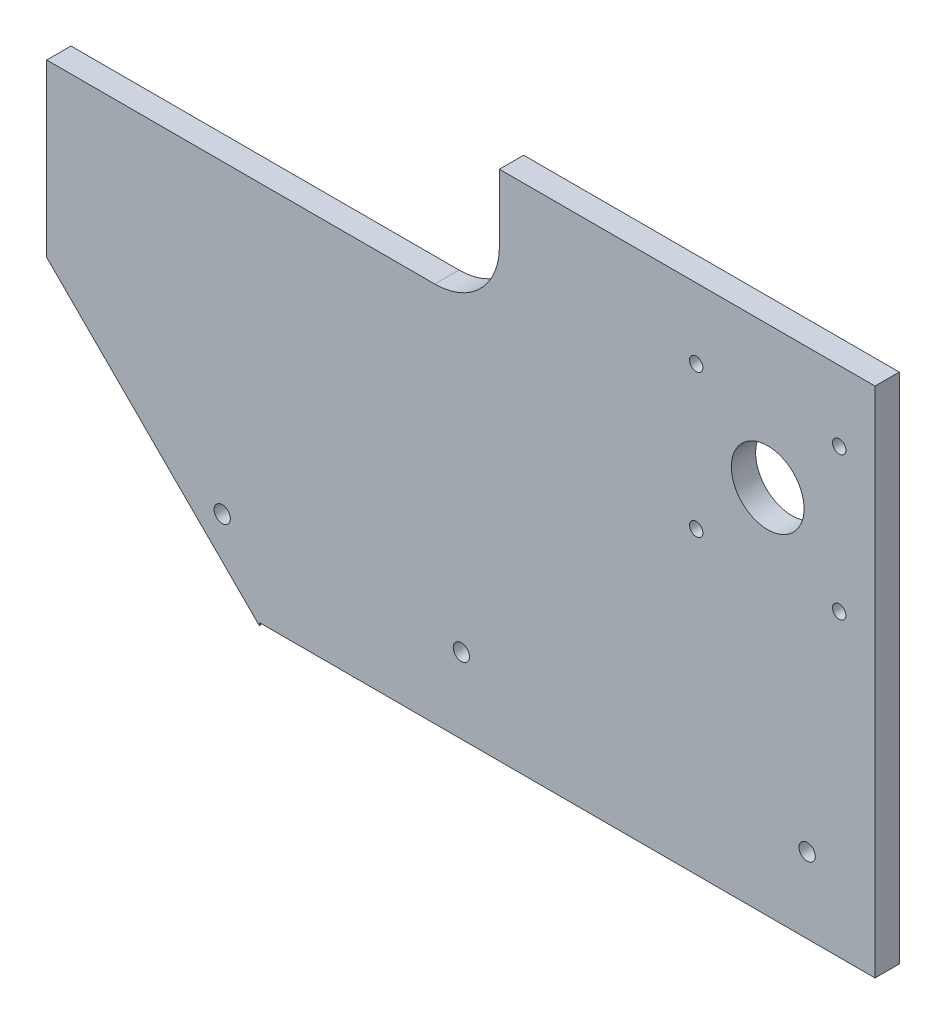
from build123d import *

# Parameters (mm, degrees)
SKETCH1_R                    = 14.2875
BOSS_EXTRUDE1_DEPTH          = 9.525
SKETCH2_W                    = 261.030867205
SKETCH2_H                    = 52.546989145
CUT_EXTRUDE1_DEPTH           = 269.40946762
SKETCH4_W                    = 213.36
SKETCH4_H                    = 68.767352002
CUT_EXTRUDE2_DEPTH           = 269.40946762
FILLET2_R                    = 25.4
SKETCH16_W                   = 9.525
SKETCH16_H                   = 4.28736328
CUT_EXTRUDE3_DEPTH           = 391.823448136
SKETCH17_W                   = 147.610011278
SKETCH17_H                   = 12.7
CUT_EXTRUDE4_DEPTH           = 267.045158533
TAP_DRILL_FOR_M6X0_75_TAP1_D = 5.25
F_6_4_6_4_DIAMETER_HOLE1_D   = 6.4
CUT_EXTRUDE5_DEPTH           = 260.331237793


with BuildPart() as part:
    # Sketch1 → Boss-Extrude1 (new body)
    with BuildSketch(Plane.XY):
        Polygon((-138.259383474, 48.991487021), (32.210627804, -121.478524257), (222.710627804, -121.478524257), (222.710627804, 149.508839023), (-138.259383474, 149.508839023), align=None)
        with Locations((180.538014078, 76.831975743)):
            Circle(SKETCH1_R, mode=Mode.SUBTRACT)
    extrude(amount=BOSS_EXTRUDE1_DEPTH)

    # Sketch2 → Cut-Extrude1 (cut, through all)
    with BuildSketch(Plane.XY.offset(9.525)):
        with Locations((111.245194202, -95.205029685)):
            Rectangle(SKETCH2_W, SKETCH2_H)
    extrude(amount=-CUT_EXTRUDE1_DEPTH, mode=Mode.SUBTRACT)

    # Sketch4 → Cut-Extrude2 (cut, through all)
    with BuildSketch(Plane.XY.offset(9.525)):
        with Locations((-31.579383474, 115.125163022)):
            Rectangle(SKETCH4_W, SKETCH4_H)
    extrude(amount=-CUT_EXTRUDE2_DEPTH, mode=Mode.SUBTRACT)

    # Fillet2
    fillet2_edges = [part.edges().sort_by_distance(p)[0] for p in [
        (-138.259383474, 80.741487021, 4.7625),
        (75.100616526, 80.741487021, 4.7625),
    ]]
    fillet(fillet2_edges, radius=FILLET2_R)

    # Sketch16 → Cut-Extrude3 (cut, through all)
    with BuildSketch(Plane(origin=(222.710627804, 0, 0), x_dir=(0, 0, -1), z_dir=(1, 0, 0))):
        with Locations((-4.7625, 147.365157383)):
            Rectangle(SKETCH16_W, SKETCH16_H)
    extrude(amount=-CUT_EXTRUDE3_DEPTH, mode=Mode.SUBTRACT)

    # Sketch17 → Cut-Extrude4 (cut, through all)
    with BuildSketch(Plane(origin=(0, 0, 0), x_dir=(-1, 0, 0), z_dir=(0, 0, -1))):
        with Locations((-148.905622165, 138.871475743)):
            Rectangle(SKETCH17_W, SKETCH17_H)
    extrude(amount=-CUT_EXTRUDE4_DEPTH, mode=Mode.SUBTRACT)

    # Tap Drill for M6x0.75 Tap1 (through all)
    with Locations(Plane.XY.offset(9.525)):
        with Locations((208.638014078, 104.931975743), (152.438014078, 104.931975743), (152.438014078, 48.731975743), (208.638014078, 48.731975743)):
            Hole(TAP_DRILL_FOR_M6X0_75_TAP1_D / 2)

    # Ø6.4 (6.4) Diameter Hole1 (through all)
    with Locations(Plane.XY.offset(9.525)):
        with Locations((196.040627804, -39.314524257), (60.150627804, -39.314524257), (-33.829372196, -39.314524257)):
            Hole(F_6_4_6_4_DIAMETER_HOLE1_D / 2)

    # Sketch22 → Cut-Extrude5 (cut, through all)
    with BuildSketch(Plane.XY.offset(9.525)):
        Polygon((-102.790372196, 145.085482826), (-102.790372196, -100.339530139), (-209.67575658, -95.573995907), (-209.67575658, 145.085482826), align=None)
    extrude(amount=-CUT_EXTRUDE5_DEPTH, mode=Mode.SUBTRACT)


solid = part.part
